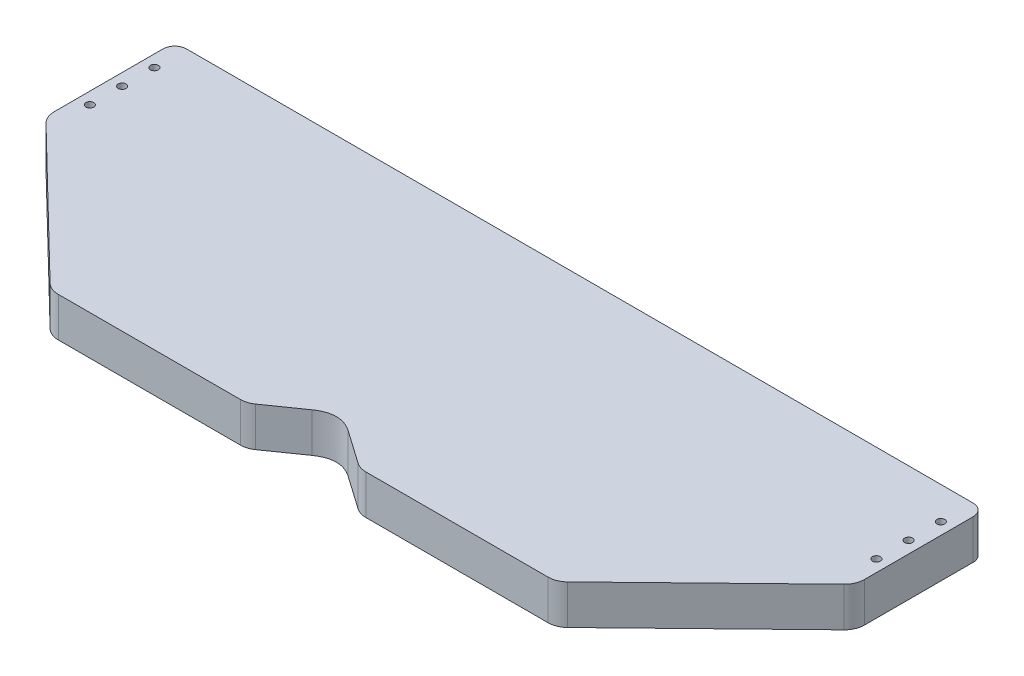
from build123d import *

# Parameters (mm, degrees)
SKETCH1_R           = 1
BOSS_EXTRUDE1_DEPTH = 5
FILLET1_R           = 5
FILLET2_R           = 5
FILLET3_R           = 5
FILLET4_R           = 3


with BuildPart() as part:
    # Sketch1 → Boss-Extrude1 (new, symmetric)
    with BuildSketch(Plane(origin=(0, 0, 0), x_dir=(1, 0, 0), z_dir=(0, 1, 0))):
        Polygon((0, -60), (-14.281480067, -70), (-64, -70), (-102.5, -32.62), (-102.5, 0), (102.5, 0), (102.5, -32.62), (64, -70), (14.281480067, -70), align=None)
        with Locations(Location((99.5, -8.16, 0), (0, 0, 270))):
            Circle(SKETCH1_R, mode=Mode.SUBTRACT)
        with Locations(Location((99.5, -16.32, 0), (0, 0, 270))):
            Circle(SKETCH1_R, mode=Mode.SUBTRACT)
        with Locations(Location((99.5, -24.48, 0), (0, 0, 270))):
            Circle(SKETCH1_R, mode=Mode.SUBTRACT)
        with Locations(Location((-99.5, -24.48, 0), (0, 0, 90))):
            Circle(SKETCH1_R, mode=Mode.SUBTRACT)
        with Locations(Location((-99.5, -16.32, 0), (0, 0, 90))):
            Circle(SKETCH1_R, mode=Mode.SUBTRACT)
        with Locations(Location((-99.5, -8.16, 0), (0, 0, 90))):
            Circle(SKETCH1_R, mode=Mode.SUBTRACT)
    extrude(amount=BOSS_EXTRUDE1_DEPTH, both=True)

    # Fillet1
    fillet1_edges = [part.edges().sort_by_distance(p)[0] for p in [
        (-14.281480067, 0, 70),
        (14.281480067, 0, 70),
    ]]
    fillet(fillet1_edges, radius=FILLET1_R)

    # Fillet2
    fillet2_edges = [part.edges().sort_by_distance(p)[0] for p in [
        (-64, 0, 70),
        (64, 0, 70),
    ]]
    fillet(fillet2_edges, radius=FILLET2_R)

    # Fillet3
    fillet3_edges = [part.edges().sort_by_distance(p)[0] for p in [
        (-102.5, 0, 32.62),
        (102.5, 0, 32.62),
    ]]
    fillet(fillet3_edges, radius=FILLET3_R)

    # Fillet4
    fillet4_edges = [part.edges().sort_by_distance(p)[0] for p in [
        (-102.5, 0, 0),
        (102.5, 0, 0),
    ]]
    fillet(fillet4_edges, radius=FILLET4_R)

    # Fillet5
    # a fillet whose section is not a circle: 8 mm, written as the material it adds along each edge
    with BuildSketch(Plane(origin=(0, -5, 60), x_dir=(-0.8191520442889911, 0, 0.5735764363510473), z_dir=(0, 1, 0))) as fillet5_piece_1:
        with BuildLine():
            Bezier((5.601660306, 0), (0, 0), (-1.915880661, 5.263838853), weights=[1, 1, 1])
            Line((-1.915880661, 5.263838853), (0, 0))
            Line((0, 0), (5.601660306, 0))
        make_face()
    extrude(amount=10)


solid = part.part
